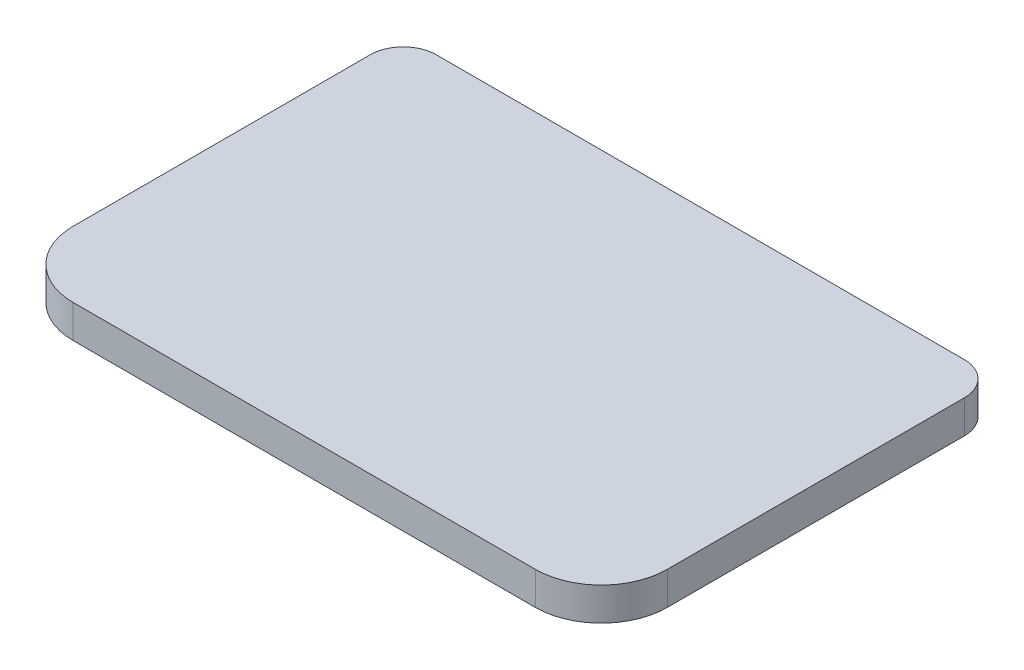
from build123d import *

# Parameters (mm, degrees)
SKETCH1_W           = 57.15
SKETCH1_H           = 38.1
BOSS_EXTRUDE1_DEPTH = 3.175
FILLET1_R           = 6.35
FILLET2_R           = 3.175


with BuildPart() as part:
    # Sketch1 → Boss-Extrude1 (new body)
    with BuildSketch(Plane(origin=(0, 0, 0), x_dir=(1, 0, 0), z_dir=(0, 1, 0))):
        Rectangle(SKETCH1_W, SKETCH1_H)
    extrude(amount=BOSS_EXTRUDE1_DEPTH)

    # Fillet1
    fillet1_edges = [part.edges().sort_by_distance(p)[0] for p in [
        (28.575, 1.5875, 19.05),
        (-28.575, 1.5875, 19.05),
    ]]
    fillet(fillet1_edges, radius=FILLET1_R)

    # Fillet2
    fillet2_edges = [part.edges().sort_by_distance(p)[0] for p in [
        (28.575, 1.5875, -19.05),
        (-28.575, 1.5875, -19.05),
    ]]
    fillet(fillet2_edges, radius=FILLET2_R)


solid = part.part
